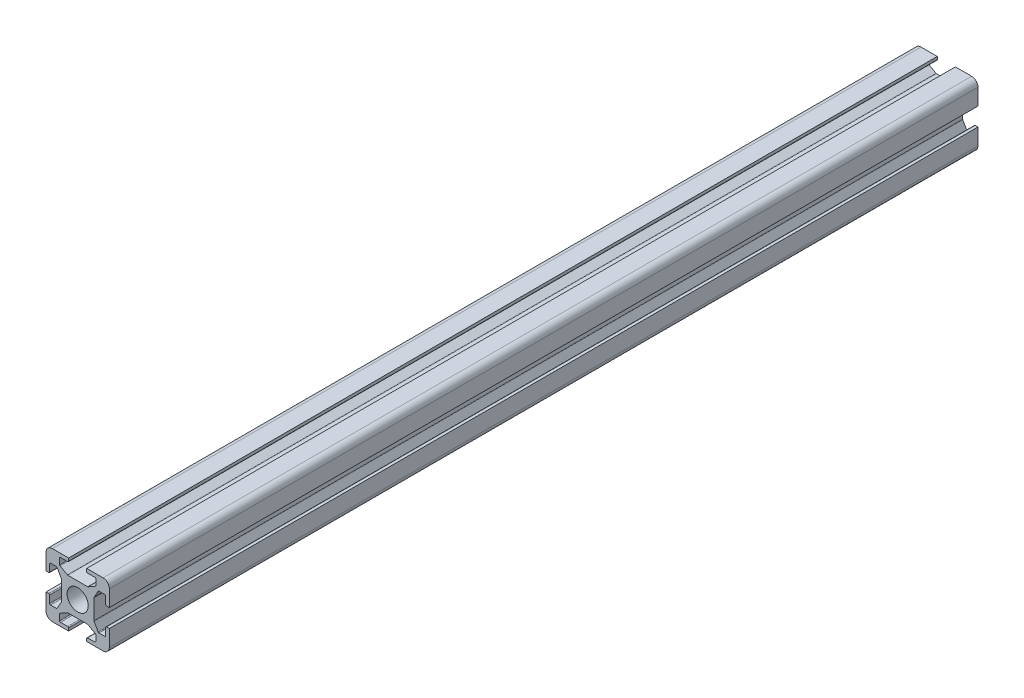
from build123d import *

# Parameters (mm, degrees)
CROQUIS1_R              = 5.85
SALIENTE_EXTRUIR1_DEPTH = 480


with BuildPart() as part:
    # Croquis1 → Saliente-Extruir1 (new body)
    with BuildSketch(Plane.XY):
        with BuildLine():
            Line((-16, -5), (-17.5, -5))
            Line((-17.5, -5), (-17.5, -14))
            ThreePointArc((-17.5, -14), (-16.474873734, -16.474873734), (-14, -17.5))
            Line((-14, -17.5), (-5, -17.5))
            Line((-5, -17.5), (-5, -16))
            ThreePointArc((-5, -16), (-5.146446609, -15.646446609), (-5.5, -15.5))
            Line((-5.5, -15.5), (-9.5, -15.5))
            ThreePointArc((-9.5, -15.5), (-9.853553391, -15.353553391), (-10, -15))
            Line((-10, -15), (-10, -11.790147321))
            ThreePointArc((-10, -11.790147321), (-9.932460283, -11.539192936), (-9.748087586, -11.356036103))
            Line((-9.748087586, -11.356036103), (-5.740718013, -9.065888782))
            ThreePointArc((-5.740718013, -9.065888782), (-5.620974478, -9.016752854), (-5.492630427, -9))
            Line((-5.492630427, -9), (5.492630427, -9))
            ThreePointArc((5.492630427, -9), (5.620974478, -9.016752854), (5.740718013, -9.065888782))
            Line((5.740718013, -9.065888782), (9.748087586, -11.356036103))
            ThreePointArc((9.748087586, -11.356036103), (9.932460283, -11.539192936), (10, -11.790147321))
            Line((10, -11.790147321), (10, -15))
            ThreePointArc((10, -15), (9.853553391, -15.353553391), (9.5, -15.5))
            Line((9.5, -15.5), (5.5, -15.5))
            ThreePointArc((5.5, -15.5), (5.146446609, -15.646446609), (5, -16))
            Line((5, -16), (5, -17.5))
            Line((5, -17.5), (14, -17.5))
            ThreePointArc((14, -17.5), (16.474873734, -16.474873734), (17.5, -14))
            Line((17.5, -14), (17.5, -5))
            Line((17.5, -5), (16, -5))
            ThreePointArc((16, -5), (15.646446609, -5.146446609), (15.5, -5.5))
            Line((15.5, -5.5), (15.5, -9.5))
            ThreePointArc((15.5, -9.5), (15.353553391, -9.853553391), (15, -10))
            Line((15, -10), (11.790147321, -10))
            ThreePointArc((11.790147321, -10), (11.539192936, -9.932460283), (11.356036103, -9.748087586))
            Line((11.356036103, -9.748087586), (9.065888782, -5.740718013))
            ThreePointArc((9.065888782, -5.740718013), (9.016752854, -5.620974478), (9, -5.492630427))
            Line((9, -5.492630427), (9, 5.492630427))
            ThreePointArc((9, 5.492630427), (9.016752854, 5.620974478), (9.065888782, 5.740718013))
            Line((9.065888782, 5.740718013), (11.356036103, 9.748087586))
            ThreePointArc((11.356036103, 9.748087586), (11.539192936, 9.932460283), (11.790147321, 10))
            Line((11.790147321, 10), (15, 10))
            ThreePointArc((15, 10), (15.353553391, 9.853553391), (15.5, 9.5))
            Line((15.5, 9.5), (15.5, 5.5))
            ThreePointArc((15.5, 5.5), (15.646446609, 5.146446609), (16, 5))
            Line((16, 5), (17.5, 5))
            Line((17.5, 5), (17.5, 14))
            ThreePointArc((17.5, 14), (16.474873734, 16.474873734), (14, 17.5))
            Line((14, 17.5), (5, 17.5))
            Line((5, 17.5), (5, 16))
            ThreePointArc((5, 16), (5.146446609, 15.646446609), (5.5, 15.5))
            Line((5.5, 15.5), (9, 15.5))
            Line((9, 15.5), (9.5, 15.5))
            ThreePointArc((9.5, 15.5), (9.853553391, 15.353553391), (10, 15))
            Line((10, 15), (10, 11.790147321))
            ThreePointArc((10, 11.790147321), (9.932460283, 11.539192936), (9.748087586, 11.356036103))
            Line((9.748087586, 11.356036103), (5.740718013, 9.065888782))
            ThreePointArc((5.740718013, 9.065888782), (5.620974478, 9.016752854), (5.492630427, 9))
            Line((5.492630427, 9), (-5.492630427, 9))
            ThreePointArc((-5.492630427, 9), (-5.620974478, 9.016752854), (-5.740718013, 9.065888782))
            Line((-5.740718013, 9.065888782), (-9.748087586, 11.356036103))
            ThreePointArc((-9.748087586, 11.356036103), (-9.932460283, 11.539192936), (-10, 11.790147321))
            Line((-10, 11.790147321), (-10, 15))
            ThreePointArc((-10, 15), (-9.853553391, 15.353553391), (-9.5, 15.5))
            Line((-9.5, 15.5), (-9, 15.5))
            Line((-9, 15.5), (-5.5, 15.5))
            ThreePointArc((-5.5, 15.5), (-5.146446609, 15.646446609), (-5, 16))
            Line((-5, 16), (-5, 17.5))
            Line((-5, 17.5), (-14, 17.5))
            ThreePointArc((-14, 17.5), (-16.474873734, 16.474873734), (-17.5, 14))
            Line((-17.5, 14), (-17.5, 5))
            Line((-17.5, 5), (-16, 5))
            ThreePointArc((-16, 5), (-15.646446609, 5.146446609), (-15.5, 5.5))
            Line((-15.5, 5.5), (-15.5, 9.5))
            ThreePointArc((-15.5, 9.5), (-15.353553391, 9.853553391), (-15, 10))
            Line((-15, 10), (-11.790147321, 10))
            ThreePointArc((-11.790147321, 10), (-11.539192936, 9.932460283), (-11.356036103, 9.748087586))
            Line((-11.356036103, 9.748087586), (-9.065888782, 5.740718013))
            ThreePointArc((-9.065888782, 5.740718013), (-9.016752854, 5.620974478), (-9, 5.492630427))
            Line((-9, 5.492630427), (-9, -5.492630427))
            ThreePointArc((-9, -5.492630427), (-9.016752854, -5.620974478), (-9.065888782, -5.740718013))
            Line((-9.065888782, -5.740718013), (-11.356036103, -9.748087586))
            ThreePointArc((-11.356036103, -9.748087586), (-11.539192936, -9.932460283), (-11.790147321, -10))
            Line((-11.790147321, -10), (-15, -10))
            ThreePointArc((-15, -10), (-15.353553391, -9.853553391), (-15.5, -9.5))
            Line((-15.5, -9.5), (-15.5, -5.5))
            ThreePointArc((-15.5, -5.5), (-15.646446609, -5.146446609), (-16, -5))
        make_face()
        Circle(CROQUIS1_R, mode=Mode.SUBTRACT)
    extrude(amount=SALIENTE_EXTRUIR1_DEPTH)


solid = part.part
